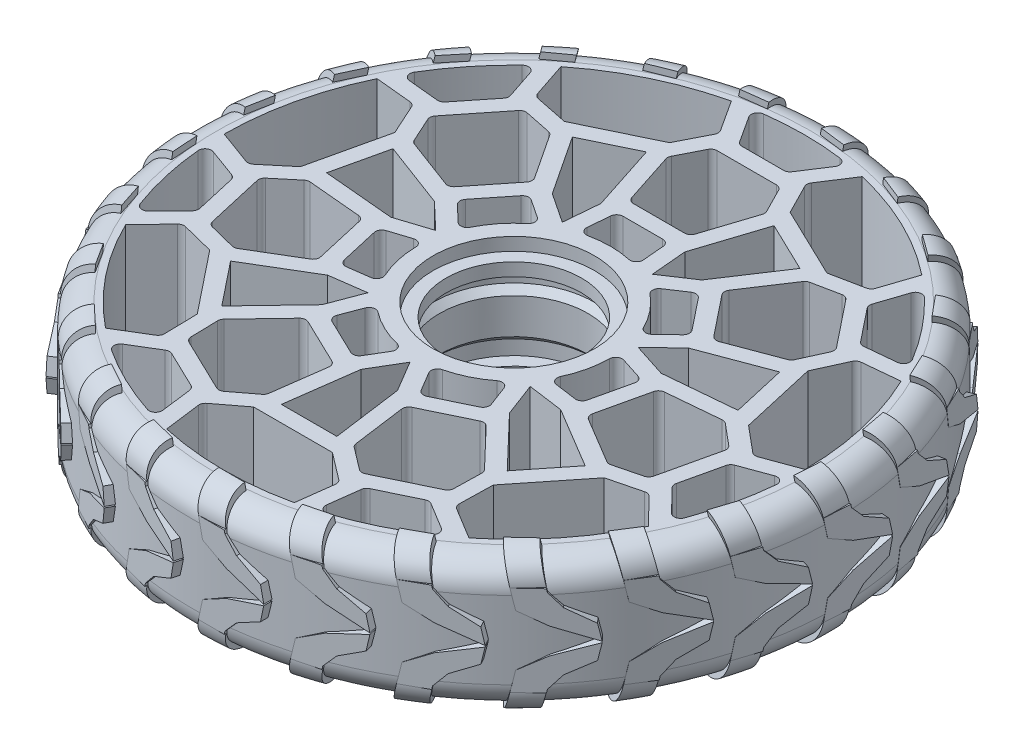
from build123d import *

# Parameters (mm, degrees)
SKETCH1_R                = 63.5
SKETCH1_R_2              = 57.15
BOSS_EXTRUDE1_DEPTH      = 25.4
SKETCH1_R_3              = 19.05
BOSS_EXTRUDE1_2_DEPTH    = 25.4
BOSS_EXTRUDE2_START      = -25.4
BOSS_EXTRUDE2_DEPTH      = 25.4
FILLET1_R                = 1.27
CIRPATTERN1_COUNT        = 7
FILLET1_OF_CIRPATTERN1_R = 1.27
BOSS_EXTRUDE3_DEPTH      = 25.4
CIRPATTERN2_COUNT        = 7
SKETCH4_R                = 15.875
CUT_EXTRUDE1_DEPTH       = 25.4
FILLET2_R                = 5.08
BOSS_EXTRUDE5_DEPTH      = 5.08
CIRPATTERN3_COUNT        = 25
SKETCH10_W               = 2.54
SKETCH10_H               = 2.54


with BuildPart() as part:
    # Sketch1 → Boss-Extrude1 (new body)
    with BuildSketch(Plane(origin=(0, 0, 0), x_dir=(1, 0, 0), z_dir=(0, 1, 0))):
        with Locations(Location((0, 0, 0), (0, 0, 270))):
            Circle(SKETCH1_R)
        with Locations(Location((0, 0, 0), (0, 0, 270))):
            Circle(SKETCH1_R_2, mode=Mode.SUBTRACT)
    extrude(amount=BOSS_EXTRUDE1_DEPTH)



with BuildPart() as body_2:
    # Sketch1 → Boss-Extrude1 2 (new body)
    with BuildSketch(Plane(origin=(0, 0, 0), x_dir=(1, 0, 0), z_dir=(0, 1, 0))):
        with Locations(Location((0, 0, 0), (0, 0, 270))):
            Circle(SKETCH1_R_3)
    extrude(amount=BOSS_EXTRUDE1_2_DEPTH)


with BuildPart() as part_1:
    add(part.part)

    add(body_2.part)  # Boss-Extrude2 merges body 2
    # Sketch2 → Boss-Extrude2 (add)
    with BuildSketch(Plane(origin=(0, 25.4, 0), x_dir=(1, 0, 0), z_dir=(0, 1, 0)).offset(BOSS_EXTRUDE2_START)):
        with BuildLine():
            Line((-5.0658323, 25.4), (5.0658323, 25.4))
            Line((5.0658323, 25.4), (5.697677134, 18.177980506))
            ThreePointArc((5.697677134, 18.177980506), (7.38496199, 17.56031994), (9.006549124, 16.786440149))
            Line((9.006549124, 16.786440149), (8.252960284, 25.4))
            Line((8.252960284, 25.4), (13.053592612, 40.174827083))
            Line((13.053592612, 40.174827083), (8.548253455, 49.017053044))
            Line((8.548253455, 49.017053044), (12.875671849, 55.680693013))
            ThreePointArc((12.875671849, 55.680693013), (11.205344205, 56.040724132), (9.525, 56.350659934))
            Line((9.525, 56.350659934), (4.7625, 49.017053044))
            Line((4.7625, 49.017053044), (-4.7625, 49.017053044))
            Line((-4.7625, 49.017053044), (-9.525, 56.350659934))
            ThreePointArc((-9.525, 56.350659934), (-11.205344205, 56.040724132), (-12.875671849, 55.680693013))
            Line((-12.875671849, 55.680693013), (-8.548253455, 49.017053044))
            Line((-8.548253455, 49.017053044), (-13.053592612, 40.174827083))
            Line((-13.053592612, 40.174827083), (-8.252960284, 25.4))
            Line((-8.252960284, 25.4), (-9.006549124, 16.786440149))
            ThreePointArc((-9.006549124, 16.786440149), (-7.38496199, 17.56031994), (-5.697677134, 18.177980506))
            Line((-5.697677134, 18.177980506), (-5.0658323, 25.4))
        make_face()
        Polygon((-5.946187758, 28.575), (5.946187758, 28.575), (9.627591252, 39.905194928), (6.602610952, 45.842053044), (-6.602610952, 45.842053044), (-9.627591252, 39.905194928), align=None, mode=Mode.SUBTRACT)
    boss_extrude2 = extrude(amount=BOSS_EXTRUDE2_DEPTH)

    # Fillet1
    fillet1_edges = [part_1.edges().sort_by_distance(p)[0] for p in [
        (8.548253455, 12.7, -49.017053044),
        (9.525, 12.7, -56.350659934),
        (4.7625, 12.7, -49.017053044),
        (-4.7625, 12.7, -49.017053044),
        (-9.525, 12.7, -56.350659934),
        (-8.548253455, 12.7, -49.017053044),
        (-5.697677134, 12.7, -18.177980506),
        (-5.0658323, 12.7, -25.4),
        (5.0658323, 12.7, -25.4),
        (5.697677134, 12.7, -18.177980506),
        (-5.946187758, 12.7, -28.575),
        (5.946187758, 12.7, -28.575),
        (9.627591252, 12.7, -39.905194928),
        (6.602610952, 12.7, -45.842053044),
        (-6.602610952, 12.7, -45.842053044),
        (-9.627591252, 12.7, -39.905194928),
    ]]
    fillet(fillet1_edges, radius=FILLET1_R)

    # CirPattern1: Boss-Extrude2 ×7 about axis
    cirpattern1_axis = Axis((0, 0, 0), (0, 1, 0))
    for i in range(1, CIRPATTERN1_COUNT):
        add(boss_extrude2.rotate(cirpattern1_axis, i * 360 / CIRPATTERN1_COUNT))

    # Fillet1 of CirPattern1
    fillet1_of_cirpattern1_edges = [part_1.edges().sort_by_distance(p)[0] for p in [
        (-32.993326395, 12.7, -37.244926361),
        (-38.117979632, 12.7, -42.581006667),
        (-35.353705066, 12.7, -34.285105125),
        (-41.292445429, 12.7, -26.838160255),
        (-49.995460357, 12.7, -27.687116926),
        (-43.6528241, 12.7, -23.878339019),
        (-17.764561034, 12.7, -6.879162104),
        (-23.017014432, 12.7, -11.87601379),
        (-16.700024878, 12.7, -19.797268144),
        (-10.65967386, 12.7, -15.788408824),
        (-26.048222039, 12.7, -13.167304298),
        (-18.633447185, 12.7, -22.465137878),
        (-25.196432747, 12.7, -32.40763602),
        (-31.724099696, 12.7, -33.744181678),
        (-39.957420885, 12.7, -23.41992346),
        (-37.201842671, 12.7, -17.353328138),
        (-49.690258528, 12.7, 2.57338953),
        (-57.057343135, 12.7, 3.253013114),
        (-48.847849133, 12.7, 6.264226241),
        (-46.728337237, 12.7, 15.550414605),
        (-52.818319344, 12.7, 21.825389841),
        (-45.885927843, 12.7, 19.241251317),
        (-16.454368145, 12.7, 9.599805672),
        (-23.635915235, 12.7, 10.59085303),
        (-25.890422704, 12.7, 0.713210415),
        (-18.99007302, 12.7, -1.509843272),
        (-26.535413837, 12.7, 12.155640104),
        (-29.181716344, 12.7, 0.561431272),
        (-41.047028974, 12.7, -0.506466194),
        (-46.16191622, 12.7, 3.763746747),
        (-43.223477908, 12.7, 16.637886169),
        (-36.76234778, 12.7, 18.265948684),
        (-28.969412493, 12.7, 40.453890617),
        (-33.031363501, 12.7, 46.637447671),
        (-25.558566489, 12.7, 42.096467481),
        (-16.976838022, 12.7, 46.229210096),
        (-15.867906567, 12.7, 54.902932901),
        (-13.565992018, 12.7, 47.871786961),
        (-2.753700435, 12.7, 18.849923976),
        (-6.456489781, 12.7, 25.082591505),
        (-15.584804166, 12.7, 20.686626985),
        (-13.020559868, 12.7, 13.905665058),
        (-7.040897793, 12.7, 28.325139578),
        (-17.755557898, 12.7, 23.165231222),
        (-25.988375177, 12.7, 31.776083007),
        (-25.838868298, 12.7, 38.437497105),
        (-13.941374469, 12.7, 44.167028161),
        (-8.640055195, 12.7, 40.130593589),
        (13.565992018, 12.7, 47.871786961),
        (15.867906567, 12.7, 54.902932901),
        (16.976838022, 12.7, 46.229210096),
        (25.558566489, 12.7, 42.096467481),
        (33.031363501, 12.7, 46.637447671),
        (28.969412493, 12.7, 40.453890617),
        (13.020559868, 12.7, 13.905665058),
        (15.584804166, 12.7, 20.686626985),
        (6.456489781, 12.7, 25.082591505),
        (2.753700435, 12.7, 18.849923976),
        (17.755557898, 12.7, 23.165231222),
        (7.040897793, 12.7, 28.325139578),
        (8.640055195, 12.7, 40.130593589),
        (13.941374469, 12.7, 44.167028161),
        (25.838868298, 12.7, 38.437497105),
        (25.988375177, 12.7, 31.776083007),
        (45.885927843, 12.7, 19.241251317),
        (52.818319344, 12.7, 21.825389841),
        (46.728337237, 12.7, 15.550414605),
        (48.847849133, 12.7, 6.264226241),
        (57.057343135, 12.7, 3.253013114),
        (49.690258528, 12.7, 2.57338953),
        (18.99007302, 12.7, -1.509843272),
        (25.890422704, 12.7, 0.713210415),
        (23.635915235, 12.7, 10.59085303),
        (16.454368145, 12.7, 9.599805672),
        (29.181716344, 12.7, 0.561431272),
        (26.535413837, 12.7, 12.155640104),
        (36.76234778, 12.7, 18.265948684),
        (43.223477908, 12.7, 16.637886169),
        (46.16191622, 12.7, 3.763746747),
        (41.047028974, 12.7, -0.506466194),
        (43.6528241, 12.7, -23.878339019),
        (49.995460357, 12.7, -27.687116926),
        (41.292445429, 12.7, -26.838160255),
        (35.353705066, 12.7, -34.285105125),
        (38.117979632, 12.7, -42.581006667),
        (32.993326395, 12.7, -37.244926361),
        (10.65967386, 12.7, -15.788408824),
        (16.700024878, 12.7, -19.797268144),
        (23.017014432, 12.7, -11.87601379),
        (17.764561034, 12.7, -6.879162104),
        (18.633447185, 12.7, -22.465137878),
        (26.048222039, 12.7, -13.167304298),
        (37.201842671, 12.7, -17.353328138),
        (39.957420885, 12.7, -23.41992346),
        (31.724099696, 12.7, -33.744181678),
        (25.196432747, 12.7, -32.40763602),
    ]]
    fillet(fillet1_of_cirpattern1_edges, radius=FILLET1_OF_CIRPATTERN1_R)

    # Sketch3 → Boss-Extrude3 (add)
    with BuildSketch(Plane(origin=(0, 25.4, 0), x_dir=(1, 0, 0), z_dir=(0, 1, 0))):
        Polygon((-38.803977582, -21.025746835), (-29.133284796, -33.152412026), (-28.085003446, -29.374610639), (-34.887629019, -20.844387979), align=None)
    boss_extrude3 = extrude(amount=-BOSS_EXTRUDE3_DEPTH)

    # CirPattern2: Boss-Extrude3 ×7 about axis
    cirpattern2_axis = Axis((0, 0, 0), (0, 1, 0))
    for i in range(1, CIRPATTERN2_COUNT):
        add(boss_extrude3.rotate(cirpattern2_axis, i * 360 / CIRPATTERN2_COUNT))

    # Sketch4 → Cut-Extrude1 (cut)
    with BuildSketch(Plane(origin=(0, 25.4, 0), x_dir=(1, 0, 0), z_dir=(0, 1, 0))):
        with Locations(Location((0, 0, 0), (0, 0, 270))):
            Circle(SKETCH4_R)
    extrude(amount=-CUT_EXTRUDE1_DEPTH, mode=Mode.SUBTRACT)

    # Fillet2
    fillet2_edges = [part_1.edges().sort_by_distance(p)[0] for p in [
        (0, 25.4, -63.5),
        (0, 0, -63.5),
    ]]
    fillet(fillet2_edges, radius=FILLET2_R)

    # Sketch5 → Boss-Extrude5 (add)
    with BuildSketch(Plane.XY.offset(63.5)):
        Polygon((0, -3.175), (5.08, -3.175), (6.666131249, 4.445), (8.933839024, 6.985), (13.662676475, 9.525), (14.297128974, 12.573), (6.97585672, 10.16), (2.247019269, 7.62), align=None)
        Polygon((2.247019269, 17.78), (6.97585672, 15.24), (14.297128974, 12.827), (13.662676475, 15.875), (8.933839024, 18.415), (6.666131249, 20.955), (5.08, 28.575), (0, 28.575), align=None)
    boss_extrude5 = extrude(amount=-BOSS_EXTRUDE5_DEPTH)

    # CirPattern3: Boss-Extrude5 ×25 about axis
    cirpattern3_axis = Axis((0, 0, 0), (0, 1, 0))
    for i in range(1, CIRPATTERN3_COUNT):
        add(boss_extrude5.rotate(cirpattern3_axis, i * 360 / CIRPATTERN3_COUNT))

    # Sketch7 → Cut-Revolve2 (revolve, cut)
    with BuildSketch(Plane(origin=(0, 0, 0), x_dir=(0, 0, -1), z_dir=(1, 0, 0)), mode=Mode.PRIVATE) as cut_revolve2_sk:
        with BuildLine():
            Line((-57.785, -1.230156248), (-54.61, -1.230156248))
            Line((-54.61, -1.230156248), (-54.61, -3.81))
            Line((-54.61, -3.81), (-64.77, -3.81))
            Line((-64.77, -3.81), (-64.77, 3.81))
            Line((-64.77, 3.81), (-63.5, 3.81))
            ThreePointArc((-63.5, 3.81), (-61.780104165, 0), (-57.785, -1.230156248))
        make_face()
        with BuildLine():
            Line((-58.42, 26.67), (-55.245, 26.67))
            Line((-55.245, 26.67), (-55.245, 29.21))
            Line((-55.245, 29.21), (-65.405, 29.21))
            Line((-65.405, 29.21), (-65.405, 21.59))
            Line((-65.405, 21.59), (-63.5, 21.59))
            ThreePointArc((-63.5, 21.59), (-62.012102448, 25.182102448), (-58.42, 26.67))
        make_face()
    revolve(cut_revolve2_sk.sketch.rotate(Axis((0, 12.7, 0), (0, 1, 0)), 179.340553533), axis=Axis((0, 12.7, 0), (0, 1, 0)), mode=Mode.SUBTRACT)

    # Sketch10 → Revolve1 (revolve)
    with BuildSketch(Plane(origin=(0, 0, 0), x_dir=(0, 0, -1), z_dir=(1, 0, 0)), mode=Mode.PRIVATE) as revolve1_sk:
        with Locations((-14.605, 21.59)):
            Rectangle(SKETCH10_W, SKETCH10_H)
        Polygon((-14.605, 16.1925), (-14.605, 9.2075), (-15.875, 7.9375), (-15.875, 17.4625), align=None)
        with Locations((-14.605, 3.81)):
            Rectangle(SKETCH10_W, SKETCH10_H)
    revolve(revolve1_sk.sketch.rotate(Axis((0, 0, 0), (0, 1, 0)), 180), axis=Axis((0, 0, 0), (0, 1, 0)))


solid = part_1.part
